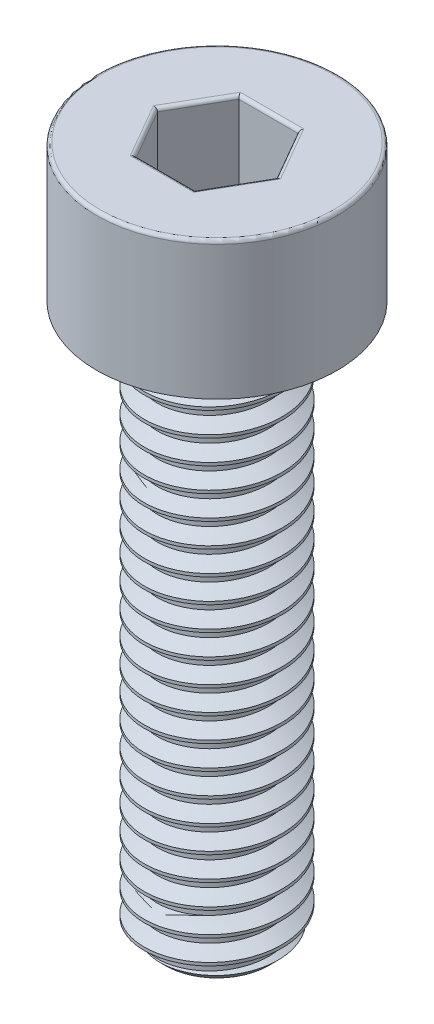
from build123d import *
from OCP.BRepFilletAPI import BRepFilletAPI_MakeChamfer
from build123d.topology import SkipClean

# Parameters (mm, degrees)
ESBO_O1_R                = 3.5
RESSALTO_EXTRUS_O1_DEPTH = 4
CORTE_EXTRUS_O1_DEPTH    = 3.5
CHANFRO3_SIZE            = 0.45
CHANFRO3_SIZE2           = 1.236364839
FILETE1_R                = 0.1
ESBO_O4_R                = 2
RESSALTO_EXTRUS_O2_DEPTH = 16
CHANFRO4_SIZE            = 0.5
FILETE2_R                = 0.2
ROSCA1_PITCH             = 0.7


with BuildPart() as part:
    # Esboço1 → Ressalto-extrusão1 (new body)
    with BuildSketch(Plane(origin=(0, 0, 0), x_dir=(1, 0, 0), z_dir=(0, 1, 0))):
        with Locations(Location((0, 0, 0), (0, 0, 270))):
            Circle(ESBO_O1_R)
    extrude(amount=RESSALTO_EXTRUS_O1_DEPTH)

    # Esboço3 → Corte-extrusão1 (cut)
    with BuildSketch(Plane(origin=(0, 4, 0), x_dir=(1, 0, 0), z_dir=(0, 1, 0))):
        Polygon((1.732050808, 0), (0.866025404, 1.5), (-0.866025404, 1.5), (-1.732050808, 0), (-0.866025404, -1.5), (0.866025404, -1.5), align=None)
    extrude(amount=-CORTE_EXTRUS_O1_DEPTH, mode=Mode.SUBTRACT)

    # Chanfro3: one chamfer whose edges measure the first distance from different faces: ONE call of the kernel's chamfer builder (chamfer() names one face for all edges)
    chanfro3_edges_1 = [part.edges().sort_by_distance(p)[0] for p in [
        (0, 0.5, -1.5),
    ]]
    chanfro3_side_1 = [part.faces().sort_by_distance(p)[0] for p in [
        (0, 2.25, -1.5),
    ]]
    chanfro3_edges_2 = [part.edges().sort_by_distance(p)[0] for p in [
        (1.299038106, 0.5, -0.75),
    ]]
    chanfro3_side_2 = [part.faces().sort_by_distance(p)[0] for p in [
        (1.299038106, 2.25, -0.75),
    ]]
    chanfro3_edges_3 = [part.edges().sort_by_distance(p)[0] for p in [
        (1.299038106, 0.5, 0.75),
    ]]
    chanfro3_side_3 = [part.faces().sort_by_distance(p)[0] for p in [
        (1.299038106, 2.25, 0.75),
    ]]
    chanfro3_edges_4 = [part.edges().sort_by_distance(p)[0] for p in [
        (0, 0.5, 1.5),
    ]]
    chanfro3_side_4 = [part.faces().sort_by_distance(p)[0] for p in [
        (0, 2.25, 1.5),
    ]]
    chanfro3_edges_5 = [part.edges().sort_by_distance(p)[0] for p in [
        (-1.299038106, 0.5, 0.75),
    ]]
    chanfro3_side_5 = [part.faces().sort_by_distance(p)[0] for p in [
        (-1.299038106, 2.25, 0.75),
    ]]
    chanfro3_edges_6 = [part.edges().sort_by_distance(p)[0] for p in [
        (-1.299038106, 0.5, -0.75),
    ]]
    chanfro3_side_6 = [part.faces().sort_by_distance(p)[0] for p in [
        (-1.299038106, 2.25, -0.75),
    ]]
    chanfro3 = BRepFilletAPI_MakeChamfer(part.part.solid().wrapped)
    for e in chanfro3_edges_1:
        chanfro3.Add(CHANFRO3_SIZE, CHANFRO3_SIZE2, e.wrapped, chanfro3_side_1[0].wrapped)  # the first distance lies on this face
    for e in chanfro3_edges_2:
        chanfro3.Add(CHANFRO3_SIZE, CHANFRO3_SIZE2, e.wrapped, chanfro3_side_2[0].wrapped)  # the first distance lies on this face
    for e in chanfro3_edges_3:
        chanfro3.Add(CHANFRO3_SIZE, CHANFRO3_SIZE2, e.wrapped, chanfro3_side_3[0].wrapped)  # the first distance lies on this face
    for e in chanfro3_edges_4:
        chanfro3.Add(CHANFRO3_SIZE, CHANFRO3_SIZE2, e.wrapped, chanfro3_side_4[0].wrapped)  # the first distance lies on this face
    for e in chanfro3_edges_5:
        chanfro3.Add(CHANFRO3_SIZE, CHANFRO3_SIZE2, e.wrapped, chanfro3_side_5[0].wrapped)  # the first distance lies on this face
    for e in chanfro3_edges_6:
        chanfro3.Add(CHANFRO3_SIZE, CHANFRO3_SIZE2, e.wrapped, chanfro3_side_6[0].wrapped)  # the first distance lies on this face
    add(Compound.cast(chanfro3.Shape()), mode=Mode.REPLACE)

    # Filete1
    filete1_edges = [part.edges().sort_by_distance(p)[0] for p in [
        (1.299038106, 4, 0.75),
        (1.299038106, 4, -0.75),
        (0, 4, -1.5),
        (-1.299038106, 4, -0.75),
        (-1.299038106, 4, 0.75),
        (0, 4, 1.5),
        (0, 4, -3.5),
    ]]
    fillet(filete1_edges, radius=FILETE1_R)

    # Esboço4 → Ressalto-extrusão2 (add)
    with BuildSketch(Plane.XZ):
        with Locations(Location((0, 0, 0), (0, 0, 270))):
            Circle(ESBO_O4_R)
    extrude(amount=RESSALTO_EXTRUS_O2_DEPTH)

    # Chanfro4
    chanfro4_edges = [part.edges().sort_by_distance(p)[0] for p in [
        (0, -16, 2),
    ]]
    chamfer(chanfro4_edges, length=CHANFRO4_SIZE)

    # Filete2
    filete2_edges = [part.edges().sort_by_distance(p)[0] for p in [
        (0, 0, 2),
    ]]
    fillet(filete2_edges, radius=FILETE2_R)

    # Rosca1: the profile of Perfil da rosca1 profile screwed along a right-hand helix of 22.571429 turns, 6 arcs to a turn; built about Z, then put on its axis
    with SkipClean():  # the faces are left unmerged after this step: merging them gives an invalid solid
        rosca1_z = Axis((0, 0, 0), (0, 0, 1))
        rosca1_corners = [(2.0003, 0, -0.000173205), (2.0003, 0, 0.612673203), (1.621113887, 0, 0.393749999), (1.621113887, 0, 0.218749999)]
        with BuildLine(mode=Mode.PRIVATE) as rosca1_profile:
            Line(rosca1_corners[0], rosca1_corners[1])
            Line(rosca1_corners[1], rosca1_corners[2])
            Line(rosca1_corners[2], rosca1_corners[3])
            Line(rosca1_corners[3], rosca1_corners[0])
        rosca1_cap = Face(rosca1_profile.wire())
        rosca1_turn_angles = [0, 30, 60, 90, 120, 150, 180, 210, 240, 270, 300, 330, 360]
        rosca1_turn_weights = [1, 0.8660254037844387, 1, 0.8660254037844387, 1, 0.8660254037844387, 1, 0.8660254037844387, 1, 0.8660254037844387, 1, 0.8660254037844387, 1]
        rosca1_turn_rails = [Edge.make_bspline([Vector(p[0], p[1], 0).rotate(rosca1_z, rosca1_turn_angles[k]) / rosca1_turn_weights[k] + Vector(0, 0, p[2] + ROSCA1_PITCH * rosca1_turn_angles[k] / 360) for k in range(13)], [0, 0, 0, 1, 1, 2, 2, 3, 3, 4, 4, 5, 5, 6, 6, 6], 2, rosca1_turn_weights) for p in rosca1_corners]
        rosca1_turn_sides = [Face.make_surface_from_curves(rosca1_turn_rails[p[0]], rosca1_turn_rails[p[1]]) for p in [(0, 1), (1, 2), (2, 3), (3, 0)]]
        rosca1_last_angles = [7920, 7950, 7980, 8010, 8040, 8070, 8100, 8112.857142857, 8125.714285714]
        rosca1_last_weights = [1, 0.8660254037844387, 1, 0.8660254037844387, 1, 0.8660254037844387, 1, 0.9749279121818226, 1]
        rosca1_last_rails = [Edge.make_bspline([Vector(p[0], p[1], 0).rotate(rosca1_z, rosca1_last_angles[k]) / rosca1_last_weights[k] + Vector(0, 0, p[2] + ROSCA1_PITCH * rosca1_last_angles[k] / 360) for k in range(9)], [0, 0, 0, 1, 1, 2, 2, 3, 3, 4, 4, 4], 2, rosca1_last_weights) for p in rosca1_corners]
        rosca1_last_sides = [Face.make_surface_from_curves(rosca1_last_rails[p[0]], rosca1_last_rails[p[1]]) for p in [(0, 1), (1, 2), (2, 3), (3, 0)]]
        rosca1 = Plane(origin=(0, -0.2, 0), x_dir=(-1, 0, 0), z_dir=(0, -1, 0)) * Solid(Shell([*[p.moved(Location((0, 0, ROSCA1_PITCH * i))) for i in range(22) for p in rosca1_turn_sides], *rosca1_last_sides, rosca1_cap, rosca1_cap.rotate(rosca1_z, 8125.714285714).moved(Location((0, 0, ROSCA1_PITCH * 8125.714285714 / 360)))]))
        add(rosca1, mode=Mode.SUBTRACT)


solid = part.part
